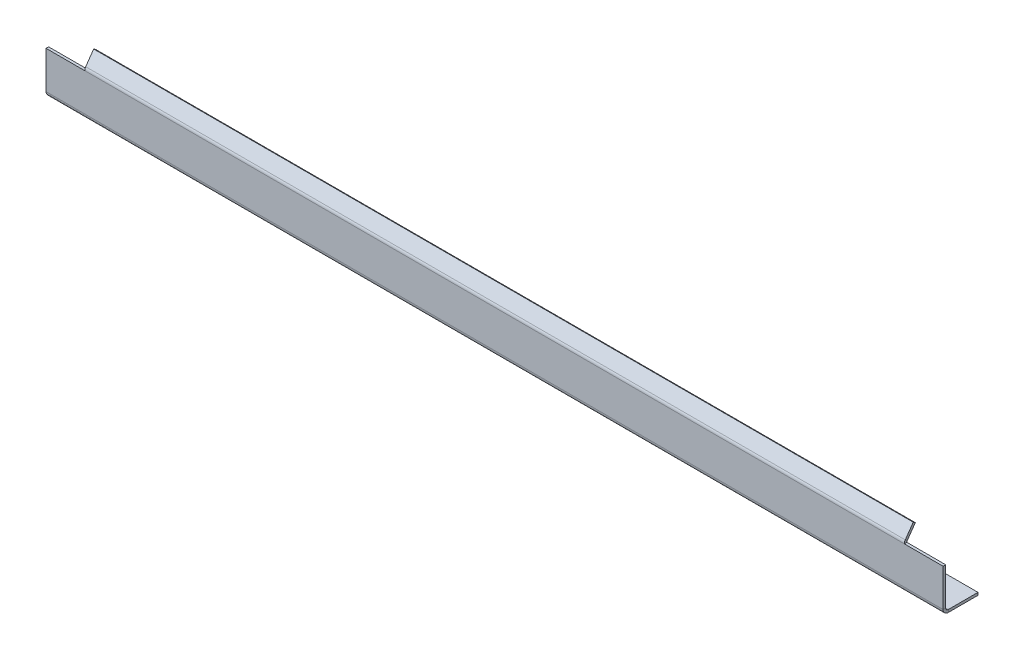
from build123d import *

# Parameters (mm, degrees)
SKETCH1_W                    = 694
SKETCH1_H                    = 33
BASE_FLANGE1_DEPTH           = 2
EDGE_FLANGE1_STRIP_W         = 12
EDGE_FLANGE1_STRIP_H         = 2
EDGE_FLANGE1_STRIP_CUT_DEPTH = 694
EDGE_FLANGE1_DEPTH           = 694
EDGE_FLANGE2_DEPTH           = 634


# Sheet-metal steps are written as plain solids
with BuildPart() as part:
    # Sketch1 → Base-Flange1 (new body)
    with BuildSketch(Plane.XY):
        Rectangle(SKETCH1_W, SKETCH1_H)
    extrude(amount=BASE_FLANGE1_DEPTH)

    # Edge-Flange1 strip (across the edge) → Edge-Flange1 strip cut (cut)
    with BuildSketch(Plane(origin=(347, -16.5, 0), x_dir=(0, 1, 0), z_dir=(-1, 0, 0))):
        with Locations((-2, -1)):
            Rectangle(EDGE_FLANGE1_STRIP_W, EDGE_FLANGE1_STRIP_H)
    extrude(amount=EDGE_FLANGE1_STRIP_CUT_DEPTH, mode=Mode.SUBTRACT)

    # Edge-Flange1 section (across the edge) → Edge-Flange1 (add)
    with BuildSketch(Plane(origin=(347, -16.5, 0), x_dir=(0, 1, 0), z_dir=(-1, 0, 0))):
        with BuildLine():
            Line((0, 2), (0, 25))
            Line((0, 25), (2, 25))
            Line((2, 25), (2, 2))
            ThreePointArc((2, 2), (2.585786438, 0.585786438), (4, 0))
            Line((4, 0), (4, -2))
            ThreePointArc((4, -2), (1.171572875, -0.828427125), (0, 2))
        make_face()
    extrude(amount=EDGE_FLANGE1_DEPTH)

    # Edge-Flange2 section (across the edge) → Edge-Flange2 (add)
    with BuildSketch(Plane(origin=(-317, 17.130597578, 0), x_dir=(0, -0.5735764363510416, -0.8191520442889949), z_dir=(1, 0, 0))):
        with BuildLine():
            Line((-2, 0.630597578), (-2, 11.369402422))
            Line((-2, 11.369402422), (0, 11.369402422))
            Line((0, 11.369402422), (0, 0.630597578))
            ThreePointArc((0, 0.630597578), (0.092566099, 0.029185979), (0.361695911, -0.516555295))
            Line((0.361695911, -0.516555295), (-1.276608177, -1.663708168))
            ThreePointArc((-1.276608177, -1.663708168), (-1.814867803, -0.57222562), (-2, 0.630597578))
        make_face()
    extrude(amount=EDGE_FLANGE2_DEPTH)


solid = part.part
